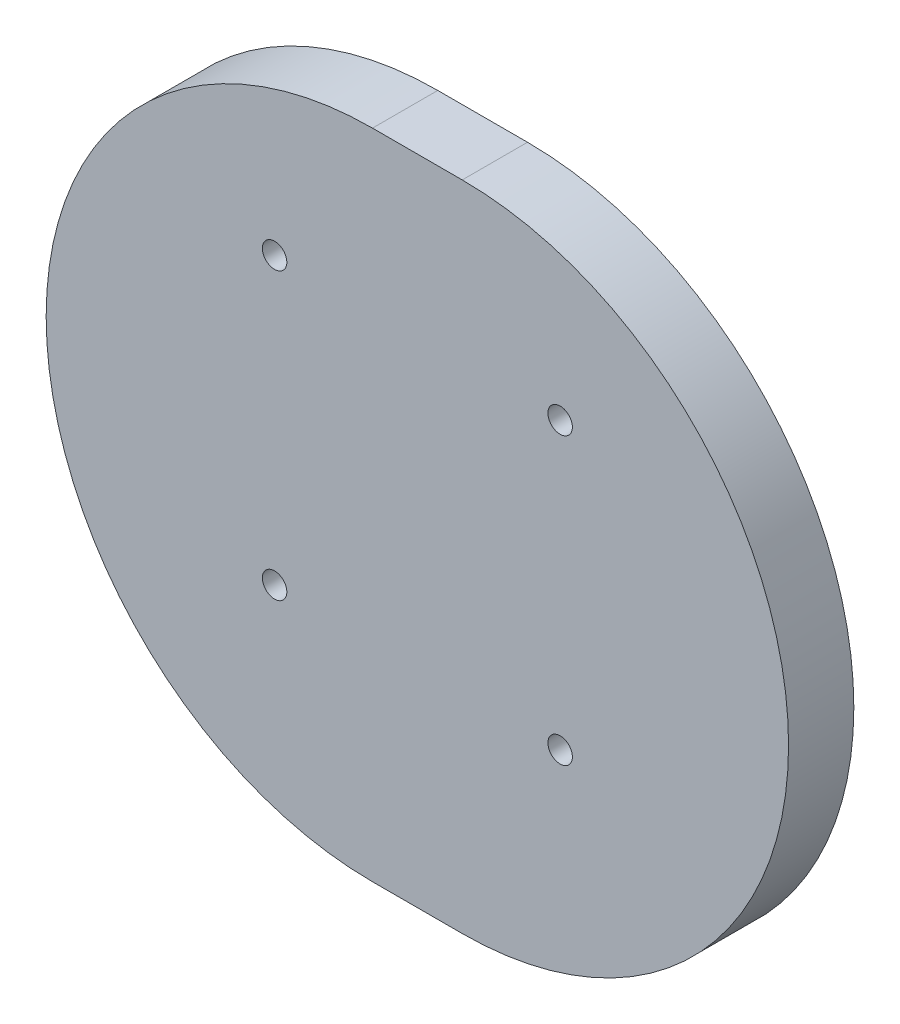
from build123d import *

# Parameters (mm, degrees)
SKETCH1_R           = 0.3
BOSS_EXTRUDE1_DEPTH = 1.6


with BuildPart() as part:
    # Sketch1 → Boss-Extrude1 (new body)
    with BuildSketch(Plane.XY):
        with BuildLine():
            Line((-1.1, 8), (1.1, 8))
            ThreePointArc((1.1, 8), (9.1, 0), (1.1, -8))
            Line((1.1, -8), (-1.1, -8))
            ThreePointArc((-1.1, -8), (-9.1, 0), (-1.1, 8))
        make_face()
        with Locations((3.5, 4.1)):
            Circle(SKETCH1_R, mode=Mode.SUBTRACT)
        with Locations((-3.5, 4.1)):
            Circle(SKETCH1_R, mode=Mode.SUBTRACT)
        with Locations((-3.5, -2.9)):
            Circle(SKETCH1_R, mode=Mode.SUBTRACT)
        with Locations((3.5, -2.9)):
            Circle(SKETCH1_R, mode=Mode.SUBTRACT)
    extrude(amount=BOSS_EXTRUDE1_DEPTH)


solid = part.part
